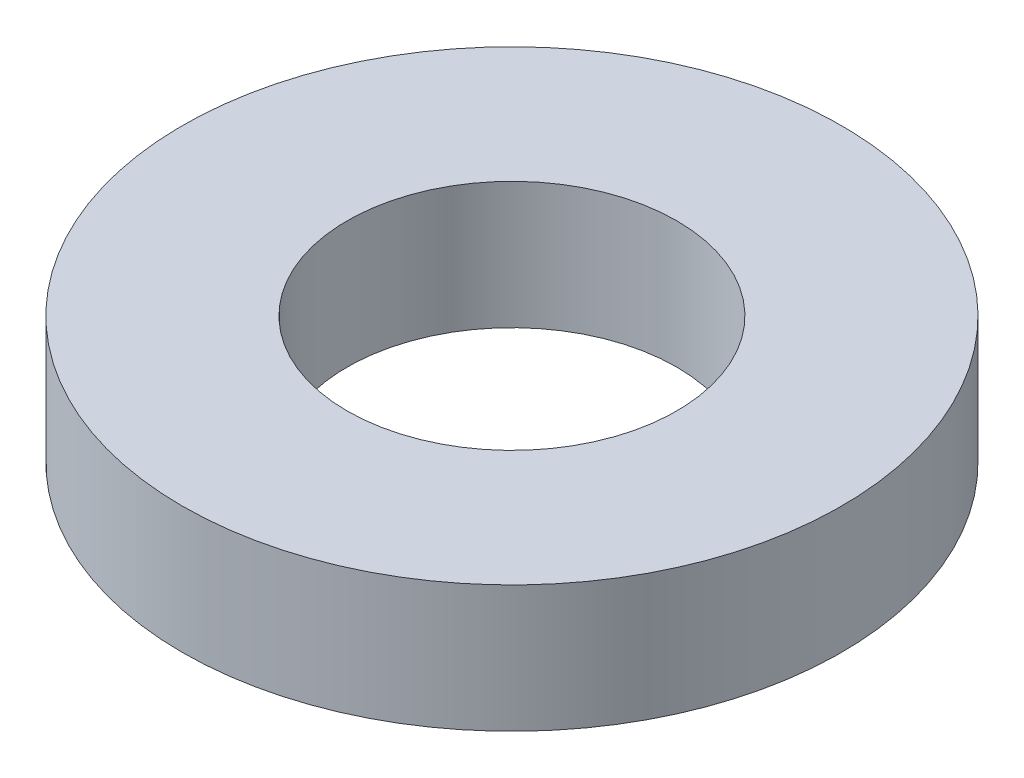
from build123d import *

# Parameters (mm, degrees)
SKETCH1_R           = 3.302
SKETCH1_R_2         = 1.651
BOSS_EXTRUDE1_DEPTH = 1.27


with BuildPart() as part:
    # Sketch1 → Boss-Extrude1 (new body)
    with BuildSketch(Plane(origin=(0, 0, 0), x_dir=(1, 0, 0), z_dir=(0, 1, 0))):
        Circle(SKETCH1_R)
        Circle(SKETCH1_R_2, mode=Mode.SUBTRACT)
    extrude(amount=BOSS_EXTRUDE1_DEPTH)


solid = part.part
